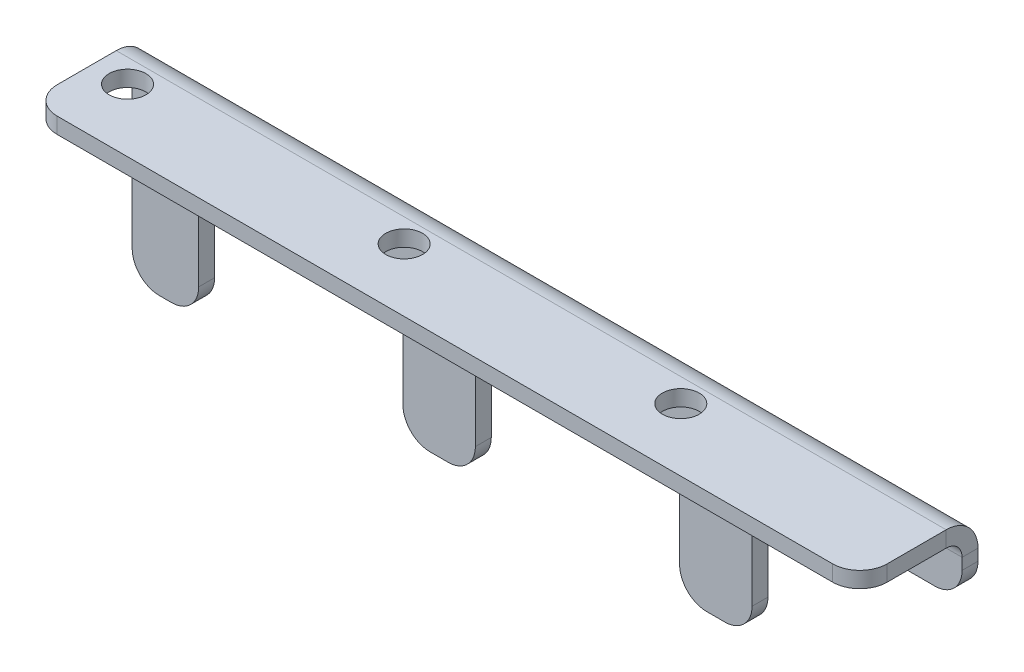
from build123d import *

# Parameters (mm, degrees)
BASE_FLANGE1_DEPTH        = 1.1684
EDGE_FLANGE1_DEPTH        = 60.96
TAP_DRILL_FOR_6_32_TAP1_D = 2.7051
FILLET1_R                 = 2


# Sheet-metal steps are written as plain solids
with BuildPart() as part:
    # Sketch1 → Base-Flange1 (new body)
    with BuildSketch(Plane(origin=(0, 0, 0), x_dir=(1, 0, 0), z_dir=(0, 0, -1))):
        Polygon((0, 0), (60.96, 0), (60.96, 2.8316), (45.53, 2.8316), (45.53, 12.8316), (40.21, 12.8316), (40.21, 2.8316), (25.21, 2.8316), (25.21, 12.8316), (19.89, 12.8316), (19.89, 2.8316), (4.89, 2.8316), (4.89, 12.8316), (0, 12.8316), (0, 2.8316), align=None)
    extrude(amount=-BASE_FLANGE1_DEPTH)

    # Edge-Flange1 section (across the edge) → Edge-Flange1 (add)
    with BuildSketch(Plane(origin=(60.96, 1.1684, 1.1684), x_dir=(0, -1, 0), z_dir=(-1, 0, 0))):
        with BuildLine():
            Line((-1.1684, 1.1684), (-1.1684, 7.5052))
            Line((-1.1684, 7.5052), (0, 7.5052))
            Line((0, 7.5052), (0, 1.1684))
            ThreePointArc((0, 1.1684), (0.342216437, 0.342216437), (1.1684, 0))
            Line((1.1684, 0), (1.1684, -1.1684))
            ThreePointArc((1.1684, -1.1684), (-0.483967126, -0.483967126), (-1.1684, 1.1684))
        make_face()
    extrude(amount=EDGE_FLANGE1_DEPTH)

    # Tap Drill for #6-32 Tap1 (through all)
    with Locations(Plane(origin=(0, 2.3368, 0), x_dir=(1, 0, 0), z_dir=(0, 1, 0))):
        with Locations((2.55, -4.06), (22.87, -4.06), (43.19, -4.06)):
            Hole(TAP_DRILL_FOR_6_32_TAP1_D / 2)

    # Fillet1
    fillet1_edges = [part.edges().sort_by_distance(p)[0] for p in [
        (0, -12.8316, 0.5842),
        (4.89, -12.8316, 0.5842),
        (4.89, -2.8316, 0.5842),
        (19.89, -2.8316, 0.5842),
        (19.89, -12.8316, 0.5842),
        (25.21, -12.8316, 0.5842),
        (25.21, -2.8316, 0.5842),
        (40.21, -2.8316, 0.5842),
        (40.21, -12.8316, 0.5842),
        (45.53, -12.8316, 0.5842),
        (45.53, -2.8316, 0.5842),
        (60.96, -2.8316, 0.5842),
        (60.96, 1.7526, 8.6736),
        (0, 1.7526, 8.6736),
    ]]
    fillet(fillet1_edges, radius=FILLET1_R)


solid = part.part
